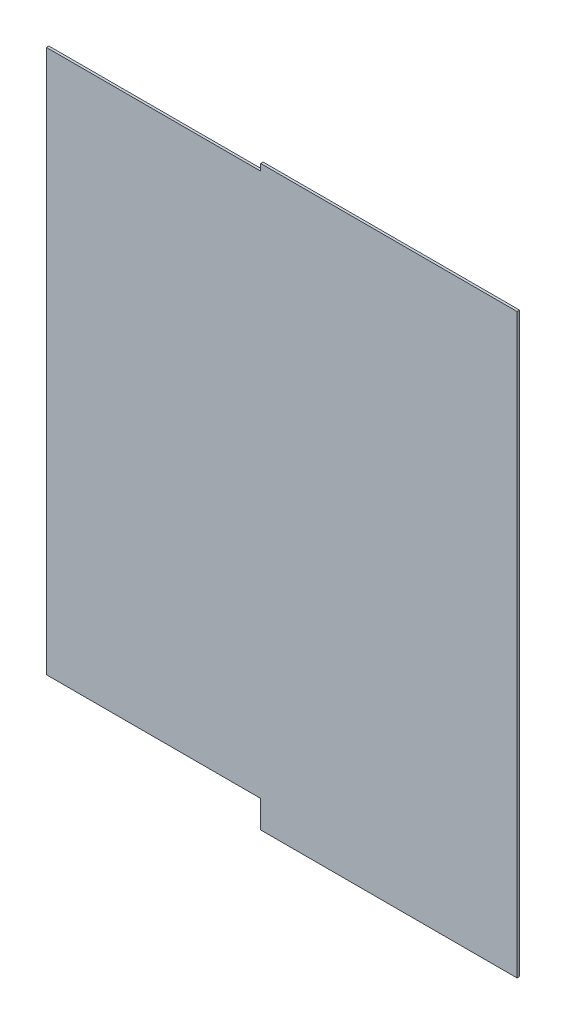
from build123d import *

# Parameters (mm, degrees)
EXTRUDE_1_DEPTH = 6


with BuildPart() as part:
    # Эскиз1 → Бобышка-Вытянуть1 (new body)
    with BuildSketch(Plane.XY):
        Polygon((0, -883), (518, -883), (518, -949), (1138.3, -949), (1138.3, 447), (518, 447), (518, 431), (0, 431), align=None)
    extrude(amount=-EXTRUDE_1_DEPTH)


solid = part.part
